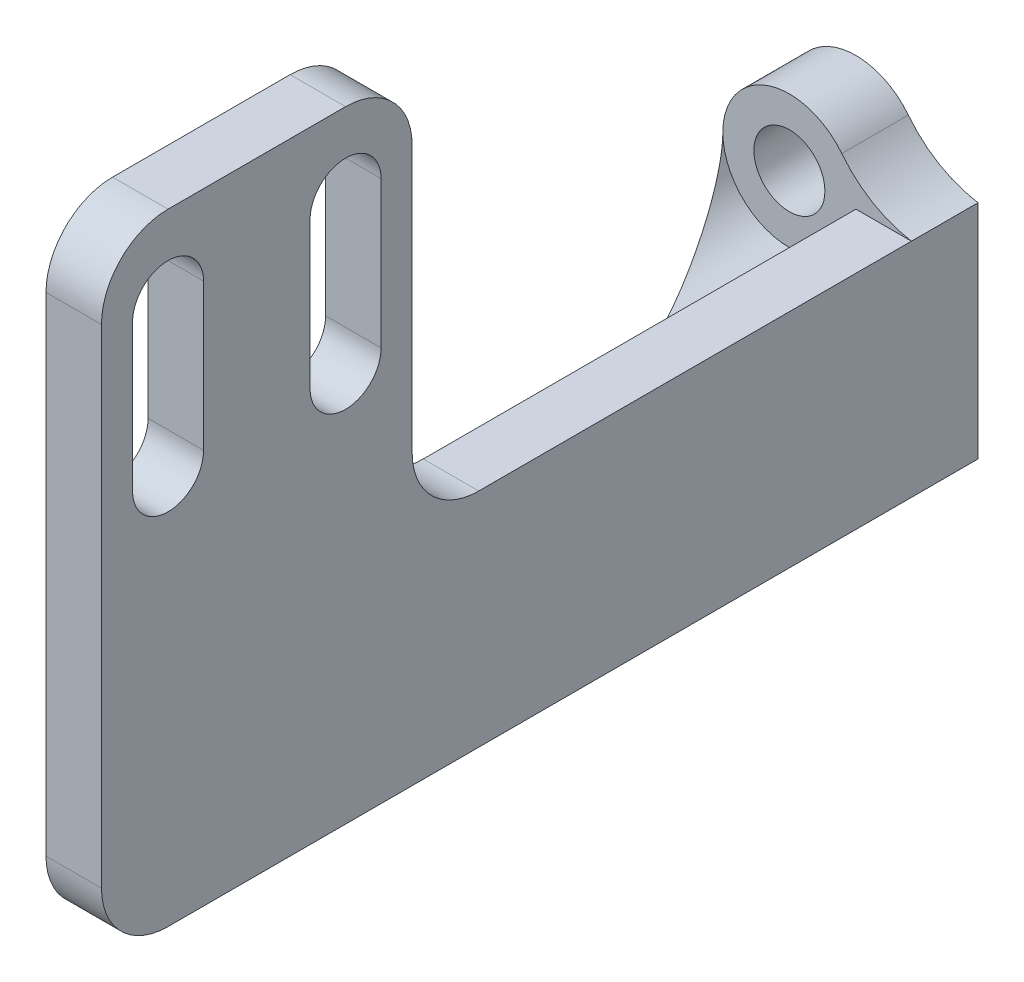
from build123d import *

# Parameters (mm, degrees)
SKETCH_1_R          = 1.6
EXTRUDE_1_DEPTH     = 3
SKETCH_3_W          = 2.5
SKETCH_3_H          = 10
EXTRUDE_2_DEPTH     = 36.5
FILLET_1_R          = 5
FILLET_2_R          = 5
SKETCH_4_W          = 14
SKETCH_4_H          = 18
EXTRUDE_3_DEPTH     = 2.5
CUT_EXTRUDE_1_DEPTH = 62.232764559
EXTRUDE_4_DEPTH     = 10
SKETCH_8_R          = 3
CUT_EXTRUDE_2_DEPTH = 59.986875282
FILLET_3_R          = 3


with BuildPart() as part:
    # 草图1 → 凸台-拉伸1 (new body)
    with BuildSketch(Plane.XY):
        with BuildLine():
            ThreePointArc((3, -33.010340746), (0, -30.010340746), (-3, -33.010340746))
            Line((-3, -33.010340746), (-3, -43.010340746))
            ThreePointArc((-3, -43.010340746), (0, -46.010340746), (3, -43.010340746))
            Line((3, -43.010340746), (5.5, -43.010340746))
            Line((5.5, -43.010340746), (5.5, -33.010340746))
            Line((5.5, -33.010340746), (3, -33.010340746))
        make_face()
        with Locations((0, -33.010340746)):
            Circle(SKETCH_1_R, mode=Mode.SUBTRACT)
        with Locations((0, -43.010340746)):
            Circle(SKETCH_1_R, mode=Mode.SUBTRACT)
    extrude(amount=EXTRUDE_1_DEPTH)

    # 草图3 → 凸台-拉伸2 (add)
    with BuildSketch(Plane.XY.offset(3)):
        with Locations((4.25, -38.010340746)):
            Rectangle(SKETCH_3_W, SKETCH_3_H)
    extrude(amount=EXTRUDE_2_DEPTH)

    # 圆角1
    # the kernel refuses this fillet: 5 mm, written as the material it adds along each edge
    with BuildSketch(Plane(origin=(3, -43.010340746, 0), x_dir=(-0.32639560491693326, -0.9452332564456825, 0), z_dir=(0, 0, 1))) as fillet_1_piece_1:
        with BuildLine():
            CenterArc((3.590351654, 4.726166282), FILLET_1_R, 208.20428203, 42.745569225)
            Line((-0.815989012, 2.363083141), (0, 0))
            ThreePointArc((0, 0), (0.979186815, 0.164300231), (1.95837363, 0))
        make_face()
    extrude(amount=3)

    # 圆角2
    # the kernel refuses this fillet: 5 mm, written as the material it adds along each edge
    with BuildSketch(Plane(origin=(3, -33.010340746, 0), x_dir=(1, 0, 0), z_dir=(0, 0, 1))) as fillet_2_piece_1:
        with BuildLine():
            CenterArc((3.295454545, 4.936319688), FILLET_2_R, 218.100297491, 42.745569225)
            ThreePointArc((-0.639204545, 1.851119883), (-0.164300231, 0.979186815), (0, 0))
            Line((0, 0), (2.5, 0))
        make_face()
    extrude(amount=3)

    # 草图4 → 凸台-拉伸3 (add)
    with BuildSketch(Plane(origin=(5.5, 0, 0), x_dir=(0, 0, -1), z_dir=(1, 0, 0))):
        with Locations((-32.5, -24.010340746)):
            Rectangle(SKETCH_4_W, SKETCH_4_H)
    extrude(amount=-EXTRUDE_3_DEPTH)

    # 草图5 → 切除-拉伸1 (cut, through all)
    with BuildSketch(Plane(origin=(5.5, 0, 0), x_dir=(0, 0, -1), z_dir=(1, 0, 0))):
        with BuildLine():
            Line((-34.9, -18.617918523), (-34.9, -25.223242404))
            ThreePointArc((-34.9, -25.223242404), (-36.5, -26.823242404), (-38.1, -25.223242404))
            Line((-38.1, -25.223242404), (-38.1, -18.617918523))
            ThreePointArc((-38.1, -18.617918523), (-36.5, -17.017918523), (-34.9, -18.617918523))
        make_face()
        with BuildLine():
            Line((-30.1, -18.617918523), (-30.1, -25.223242404))
            ThreePointArc((-30.1, -25.223242404), (-28.5, -26.823242404), (-26.9, -25.223242404))
            Line((-26.9, -25.223242404), (-26.9, -18.617918523))
            ThreePointArc((-26.9, -18.617918523), (-28.5, -17.017918523), (-30.1, -18.617918523))
        make_face()
    extrude(amount=-CUT_EXTRUDE_1_DEPTH, mode=Mode.SUBTRACT)

    # 草图6 → 凸台-拉伸4 (add)
    with BuildSketch(Plane.XZ.offset(43.010340746)):
        Polygon((3, 14), (-3, 3), (3, 3), align=None)
    extrude(amount=-EXTRUDE_4_DEPTH)

    # 草图8 → 切除-拉伸2 (cut, through all)
    with BuildSketch(Plane.XY.offset(3)):
        with Locations((0, -43.010340746)):
            Circle(SKETCH_8_R)
        with Locations((0, -33.010340746)):
            Circle(SKETCH_8_R)
    extrude(amount=CUT_EXTRUDE_2_DEPTH, mode=Mode.SUBTRACT)

    # 圆角3
    fillet_3_edges = [part.edges().sort_by_distance(p)[0] for p in [
        (4.25, -43.010340746, 39.5),
        (4.25, -33.010340746, 25.5),
        (4.25, -15.010340746, 39.5),
        (4.25, -15.010340746, 25.5),
    ]]
    fillet(fillet_3_edges, radius=FILLET_3_R)


solid = part.part
